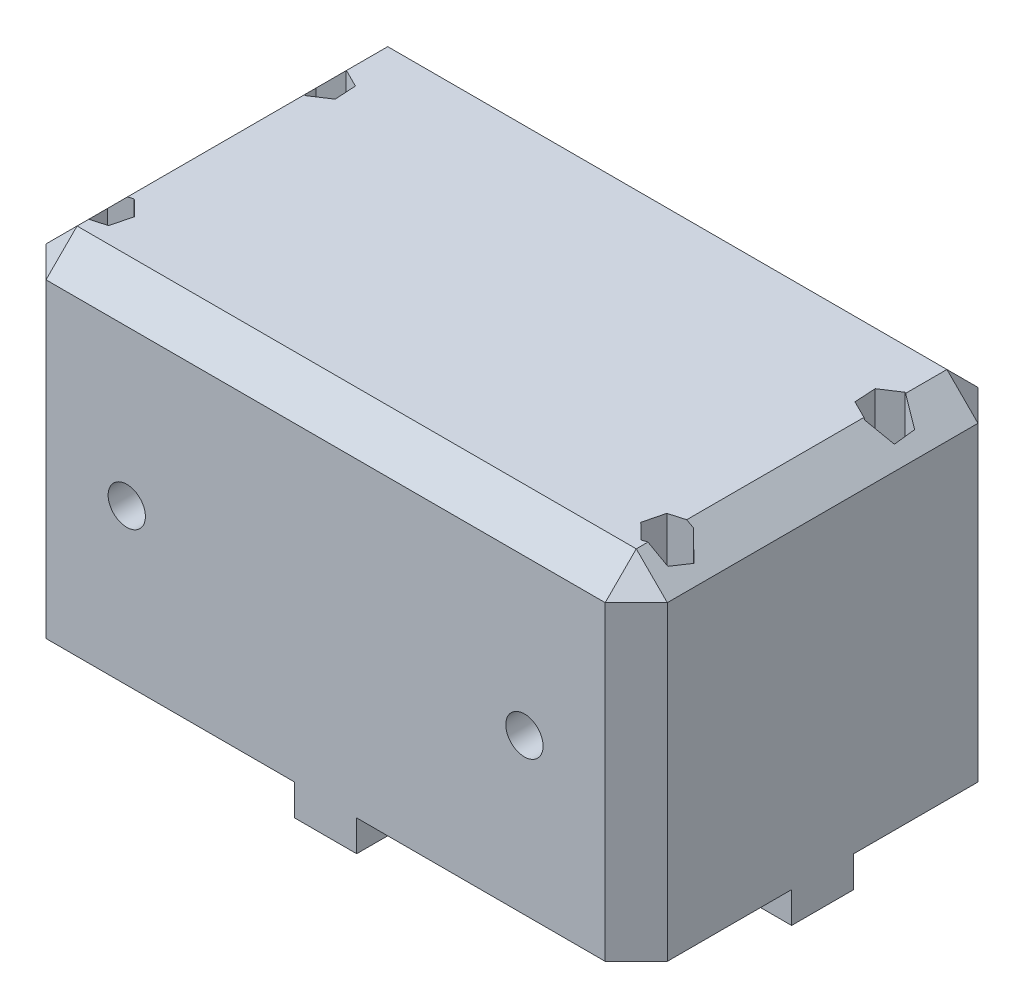
from build123d import *

# Parameters (mm, degrees)
SKETCH1_W               = 100
SKETCH1_H               = 60
BOSS_EXTRUDE1_DEPTH     = 55
CUT_EXTRUDE1_START      = -30
SKETCH2_W               = 80
SKETCH2_H               = 100
CUT_EXTRUDE1_DEPTH      = 45
CUT_EXTRUDE2_DEPTH      = 81.156097709
CUT_EXTRUDE2_DEPTH_BACK = 81.156097709
SKETCH3_R               = 1.75
CUT_EXTRUDE3_START      = 55
CUT_EXTRUDE3_DEPTH      = 52
BOSS_EXTRUDE2_START     = 15
SKETCH5_W               = 3
SKETCH5_H               = 20
BOSS_EXTRUDE2_DEPTH     = 45
CHAMFER1_SIZE           = 3
CUT_EXTRUDE4_DEPTH      = 81.156097709
CUT_EXTRUDE4_DEPTH_BACK = 81.156097709
SKETCH6_R               = 1.75
CUT_EXTRUDE5_START      = 30
SKETCH7_R               = 3
CUT_EXTRUDE5_DEPTH      = 5
BOSS_EXTRUDE3_START     = 50
SKETCH8_W               = 10
SKETCH8_H               = 5
BOSS_EXTRUDE3_DEPTH     = 5
BOSS_EXTRUDE4_START     = -50
SKETCH8_2_W             = 10
SKETCH8_2_H             = 5
BOSS_EXTRUDE4_DEPTH     = 5
BOSS_EXTRUDE5_START     = 30
SKETCH9_W               = 10
SKETCH9_H               = 5
BOSS_EXTRUDE5_DEPTH     = 5


# Some blends are built 0.0001 mm under size
with BuildPart() as part:
    # Sketch1 → Boss-Extrude1 (new body)
    with BuildSketch(Plane(origin=(0, 0, 0), x_dir=(1, 0, 0), z_dir=(0, 1, 0))):
        Rectangle(SKETCH1_W, SKETCH1_H)
    extrude(amount=BOSS_EXTRUDE1_DEPTH)

    # Sketch2 → Cut-Extrude1 (cut)
    with BuildSketch(Plane.XY.offset(CUT_EXTRUDE1_START)):
        Rectangle(SKETCH2_W, SKETCH2_H)
    extrude(amount=CUT_EXTRUDE1_DEPTH, mode=Mode.SUBTRACT)

    # Sketch3 → Cut-Extrude2 (cut, two sides: drawn at the far end of the back side and taken through both)
    with BuildSketch(Plane(origin=(0, 0, 0), x_dir=(1, 0, 0), z_dir=(0, 1, 0)).offset(-CUT_EXTRUDE2_DEPTH_BACK)):
        with Locations(Location((-45, 15, 0), (0, 0, 90))):
            Circle(SKETCH3_R)
        with Locations(Location((45, 15, 0), (0, 0, 90))):
            Circle(SKETCH3_R)
        with Locations(Location((45, -20, 0), (0, 0, 90))):
            Circle(SKETCH3_R)
        with Locations(Location((-45, -20, 0), (0, 0, 90))):
            Circle(SKETCH3_R)
    extrude(amount=CUT_EXTRUDE2_DEPTH + CUT_EXTRUDE2_DEPTH_BACK, mode=Mode.SUBTRACT)

    # Sketch4 → Cut-Extrude3 (cut)
    with BuildSketch(Plane(origin=(0, 0, 0), x_dir=(1, 0, 0), z_dir=(0, 1, 0)).offset(CUT_EXTRUDE3_START)):
        Polygon((44.159672203, -23.360632261), (47.490229012, -22.408061351), (48.330556809, -19.04742909), (45.840327797, -16.639367739), (42.509770988, -17.591938649), (41.669443191, -20.95257091), align=None)
        Polygon((44.794589767, 18.458006165), (41.902573698, 16.551112602), (42.107983932, 13.093106437), (45.205410233, 11.541993835), (48.097426302, 13.448887398), (47.892016068, 16.906893563), align=None)
        Polygon((-45.840327797, -23.360632261), (-42.509770988, -22.408061351), (-41.669443191, -19.04742909), (-44.159672203, -16.639367739), (-47.490229012, -17.591938649), (-48.330556809, -20.95257091), align=None)
        Polygon((-45.205410233, 18.458006165), (-48.097426302, 16.551112602), (-47.892016068, 13.093106437), (-44.794589767, 11.541993835), (-41.902573698, 13.448887398), (-42.107983932, 16.906893563), align=None)
    extrude(amount=-CUT_EXTRUDE3_DEPTH, mode=Mode.SUBTRACT)

    # Sketch5 → Boss-Extrude2 (add)
    with BuildSketch(Plane.XY.offset(BOSS_EXTRUDE2_START)):
        with Locations((-38.5, 25)):
            Rectangle(SKETCH5_W, SKETCH5_H)
        with Locations((38.5, 25)):
            Rectangle(SKETCH5_W, SKETCH5_H)
    extrude(amount=-BOSS_EXTRUDE2_DEPTH)

    # Chamfer1
    chamfer1_edges = [part.edges().sort_by_distance(p)[0] for p in [
        (37, 15, -7.5),
        (37, 35, -7.5),
        (-37, 15, -7.5),
        (-37, 35, -7.5),
    ]]
    chamfer(chamfer1_edges, length=CHAMFER1_SIZE - 0.0001)  # a hair under: the kernel refuses the full size

    # Sketch6 → Cut-Extrude4 (cut, two sides: drawn at the far end of the back side and taken through both)
    with BuildSketch(Plane.XY.offset(-CUT_EXTRUDE4_DEPTH_BACK)):
        with Locations((32, 25)):
            Circle(SKETCH6_R)
        with Locations((-32, 25)):
            Circle(SKETCH6_R)
    extrude(amount=CUT_EXTRUDE4_DEPTH + CUT_EXTRUDE4_DEPTH_BACK, mode=Mode.SUBTRACT)

    # Sketch7 → Cut-Extrude5 (cut)
    with BuildSketch(Plane.XY.offset(CUT_EXTRUDE5_START)):
        with Locations(Location((-32, 25, 0), (0, 0, 180))):
            Circle(SKETCH7_R)
        with Locations(Location((32, 25, 0), (0, 0, 180))):
            Circle(SKETCH7_R)
    extrude(amount=-CUT_EXTRUDE5_DEPTH, mode=Mode.SUBTRACT)

    # Sketch8 → Boss-Extrude3 (add)
    with BuildSketch(Plane(origin=(0, 0, 0), x_dir=(0, 0, -1), z_dir=(1, 0, 0)).offset(BOSS_EXTRUDE3_START)):
        with Locations((0, -2.5)):
            Rectangle(SKETCH8_W, SKETCH8_H)
    extrude(amount=-BOSS_EXTRUDE3_DEPTH)

    # Sketch8<2> → Boss-Extrude4 (add)
    with BuildSketch(Plane(origin=(0, 0, 0), x_dir=(0, 0, -1), z_dir=(1, 0, 0)).offset(BOSS_EXTRUDE4_START)):
        with Locations((0, -2.5)):
            Rectangle(SKETCH8_2_W, SKETCH8_2_H)
    extrude(amount=BOSS_EXTRUDE4_DEPTH)

    # Sketch9 → Boss-Extrude5 (add)
    with BuildSketch(Plane.XY.offset(BOSS_EXTRUDE5_START)):
        with Locations((0, -2.5)):
            Rectangle(SKETCH9_W, SKETCH9_H)
    extrude(amount=-BOSS_EXTRUDE5_DEPTH)

    # Chamfer2
    # the kernel refuses this chamfer: 5 mm, written as the material it takes off along each edge
    with BuildSketch(Plane(origin=(-46.666666667, 51.666666667, -26.666666667), x_dir=(0, 0.7071067811865475, 0.7071067811865475), z_dir=(-0.5773502691896257, 0.5773502691896257, -0.5773502691896257)), Plane(origin=(46.666666667, 51.666666667, 26.666666667), x_dir=(0, 0.7071067811865475, -0.7071067811865475), z_dir=(0.5773502691896257, 0.5773502691896257, 0.5773502691896257))) as chamfer2_piece_1:
        Polygon((-3.535533906, 2.041241452), (3.535533906, 2.041241452), (0, -4.082482905), align=None)
    extrude(amount=6.350852961, mode=Mode.SUBTRACT)
    with BuildSketch(Plane(origin=(46.666666667, 51.666666667, -26.666666667), x_dir=(0, 0.7071067811865475, 0.7071067811865475), z_dir=(0.577350269189626, 0.5773502691896256, -0.5773502691896256)), Plane(origin=(-46.666666667, 51.666666667, 26.666666667), x_dir=(0, 0.7071067811865475, -0.7071067811865475), z_dir=(-0.577350269189626, 0.5773502691896256, 0.5773502691896256))) as chamfer2_piece_2:
        Polygon((-3.535533906, -2.041241452), (3.535533906, -2.041241452), (0, 4.082482905), align=None)
    extrude(amount=6.350852961, mode=Mode.SUBTRACT)
    with BuildSketch(Plane(origin=(-50, -12.85841494, -30), x_dir=(0.9996219169112968, 0, -0.027495876610586317), z_dir=(0, 1, 0)), Plane(origin=(-50, -12.85841494, 30), x_dir=(-0.027495876610586317, 0, -0.9996219169112968), z_dir=(0, 1, 0))) as chamfer2_piece_3:
        with BuildLine():
            Line((5.143365976, 0), (-0.282735774, -5.135588968))
            Line((-0.282735774, -5.135588968), (-0.382697966, -5.13283938))
            ThreePointArc((-0.382697966, -5.13283938), (-0.170646135, -2.566989148), (-0.099962192, 0.002749588))
            Line((-0.099962192, 0.002749588), (0.002749588, 0.099962192))
            ThreePointArc((0.002749588, 0.099962192), (2.572488324, 0.029278248), (5.146115564, 0.099962192))
            Line((5.146115564, 0.099962192), (5.143365976, 0))
        make_face()
    extrude(amount=80.71682988, mode=Mode.SUBTRACT)
    with BuildSketch(Plane(origin=(50, -12.85841494, -30), x_dir=(-0.9996219169112968, 0, -0.027495876610586317), z_dir=(0, 1, 0)), Plane(origin=(50, -12.85841494, 30), x_dir=(0.027495876610586317, 0, -0.9996219169112968), z_dir=(0, 1, 0))) as chamfer2_piece_4:
        with BuildLine():
            Line((5.143365976, 0), (-0.282735774, 5.135588968))
            Line((-0.282735774, 5.135588968), (-0.382697966, 5.13283938))
            ThreePointArc((-0.382697966, 5.13283938), (-0.170646135, 2.566989148), (-0.099962192, -0.002749588))
            Line((-0.099962192, -0.002749588), (0.002749588, -0.099962192))
            ThreePointArc((0.002749588, -0.099962192), (2.572488324, -0.029278248), (5.146115564, -0.099962192))
            Line((5.146115564, -0.099962192), (5.143365976, 0))
        make_face()
    extrude(amount=80.71682988, mode=Mode.SUBTRACT)
    with BuildSketch(Plane(origin=(50, 55, 42.85841494), x_dir=(-0.9996219169112968, 0.027495876610586317, 0), z_dir=(0, 0, -1))) as chamfer2_piece_5:
        with BuildLine():
            Line((5.143365976, 0), (-0.282735774, -5.135588968))
            Line((-0.282735774, -5.135588968), (-0.382697966, -5.13283938))
            ThreePointArc((-0.382697966, -5.13283938), (-0.170646135, -2.566989148), (-0.099962192, 0.002749588))
            Line((-0.099962192, 0.002749588), (0.002749588, 0.099962192))
            ThreePointArc((0.002749588, 0.099962192), (2.572488324, 0.029278248), (5.146115564, 0.099962192))
            Line((5.146115564, 0.099962192), (5.143365976, 0))
        make_face()
    extrude(amount=85.71682988, mode=Mode.SUBTRACT)
    with BuildSketch(Plane(origin=(-50, 55, -42.85841494), x_dir=(-0.027495876610586317, -0.9996219169112968, 0), z_dir=(0, 0, 1))) as chamfer2_piece_6:
        with BuildLine():
            Line((5.143365976, 0), (-0.282735774, 5.135588968))
            Line((-0.282735774, 5.135588968), (-0.382697966, 5.13283938))
            ThreePointArc((-0.382697966, 5.13283938), (-0.170646135, 2.566989148), (-0.099962192, -0.002749588))
            Line((-0.099962192, -0.002749588), (0.002749588, -0.099962192))
            ThreePointArc((0.002749588, -0.099962192), (2.572488324, -0.029278248), (5.146115564, -0.099962192))
            Line((5.146115564, -0.099962192), (5.143365976, 0))
        make_face()
    extrude(amount=85.71682988, mode=Mode.SUBTRACT)
    with BuildSketch(Plane(origin=(-62.85841494, 55, 30), x_dir=(0, 0.027495876610586317, -0.9996219169112968), z_dir=(1, 0, 0))) as chamfer2_piece_7:
        with BuildLine():
            Line((5.143365976, 0), (-0.282735774, -5.135588968))
            Line((-0.282735774, -5.135588968), (-0.382697966, -5.13283938))
            ThreePointArc((-0.382697966, -5.13283938), (-0.170646135, -2.566989148), (-0.099962192, 0.002749588))
            Line((-0.099962192, 0.002749588), (0.002749588, 0.099962192))
            ThreePointArc((0.002749588, 0.099962192), (2.572488324, 0.029278248), (5.146115564, 0.099962192))
            Line((5.146115564, 0.099962192), (5.143365976, 0))
        make_face()
    extrude(amount=125.71682988, mode=Mode.SUBTRACT)
    with BuildSketch(Plane(origin=(62.85841494, 55, -30), x_dir=(0, -0.9996219169112968, -0.027495876610586317), z_dir=(-1, 0, 0))) as chamfer2_piece_8:
        with BuildLine():
            Line((5.143365976, 0), (-0.282735774, 5.135588968))
            Line((-0.282735774, 5.135588968), (-0.382697966, 5.13283938))
            ThreePointArc((-0.382697966, 5.13283938), (-0.170646135, 2.566989148), (-0.099962192, -0.002749588))
            Line((-0.099962192, -0.002749588), (0.002749588, -0.099962192))
            ThreePointArc((0.002749588, -0.099962192), (2.572488324, -0.029278248), (5.146115564, -0.099962192))
            Line((5.146115564, -0.099962192), (5.143365976, 0))
        make_face()
    extrude(amount=125.71682988, mode=Mode.SUBTRACT)


solid = part.part
